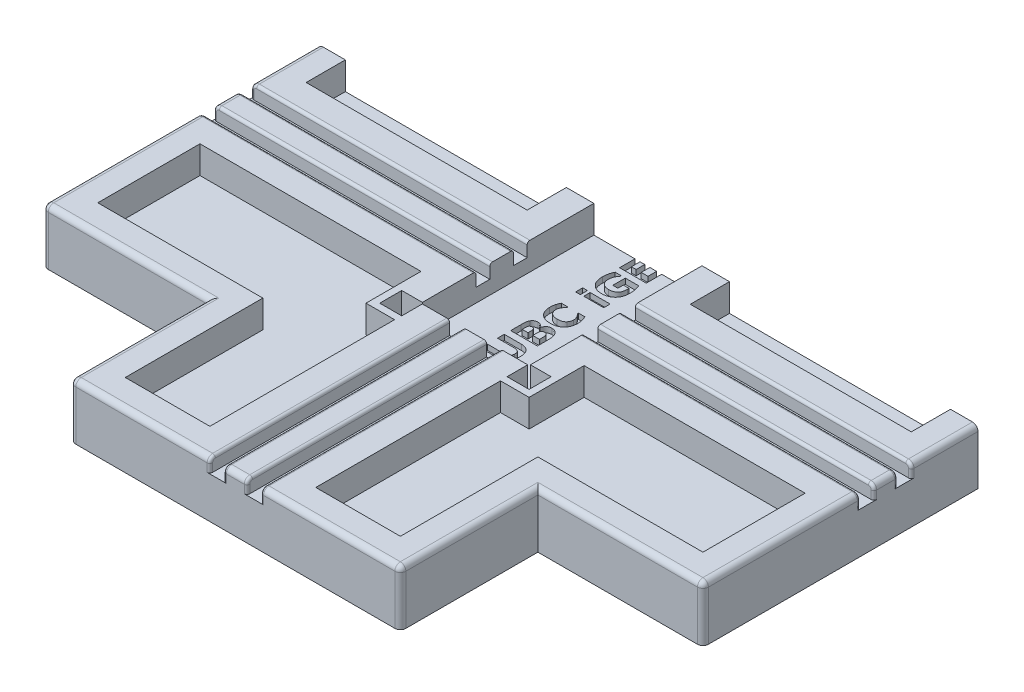
from build123d import *

# Parameters (mm, degrees)
SKETCH1_W                                  = 240
SKETCH1_H                                  = 200
BOSS_EXTRUDE1_DEPTH                        = 20
SKETCH7_W                                  = 120
SKETCH7_H                                  = 50
BOSS_EXTRUDE6_DEPTH                        = 20
FILLET1_R                                  = 2
SKETCH2_W                                  = 39.3
SKETCH2_H                                  = 125.7
CUT_EXTRUDE1_DEPTH                         = 10
CUT_EXTRUDE3_DEPTH                         = 5
MIRROR4_AT_THE_SECOND_PLANE_COPY_1_DEPTH   = 5
SKETCH11_W                                 = 104.748042719
SKETCH11_H                                 = 5
CUT_EXTRUDE4_DEPTH                         = 5
MIRROR6_AT_THE_SECOND_PLANE_COPY_1_SKETC_W = 104.748042719
MIRROR6_AT_THE_SECOND_PLANE_COPY_1_SKETC_H = 5
MIRROR6_AT_THE_SECOND_PLANE_COPY_1_DEPTH   = 5
SHELL1_START                               = 10
SHELL1_OUTLINE_W                           = 80.35
SHELL1_OUTLINE_H                           = 28.5
SHELL1_DEPTH                               = 10
FILLET3_R                                  = 1
SKETCH13_W                                 = 7.252545243
SKETCH13_H                                 = 2.335565418
SKETCH13_W_2                               = 1.720942939
SKETCH13_H_2                               = 2.581414408
CUT_EXTRUDE5_DEPTH                         = 2
CUT_EXTRUDE6_DEPTH                         = 10
MIRROR7_AT_THE_SECOND_PLANE_COPY_1_DEPTH   = 10
SKETCH15_W                                 = 252.845295914
SKETCH15_H                                 = 31.352816693
CUT_EXTRUDE7_DEPTH                         = 194.132079158


# Read off the part's stored shape, not the designer's step: Shell1
with BuildPart() as part:
    # Sketch1 → Boss-Extrude1 (new body)
    with BuildSketch(Plane(origin=(0, 0, 0), x_dir=(1, 0, 0), z_dir=(0, 1, 0))):
        Rectangle(SKETCH1_W, SKETCH1_H)
    extrude(amount=BOSS_EXTRUDE1_DEPTH)

    # Sketch7 → Boss-Extrude6 (add)
    with BuildSketch(Plane(origin=(0, 0, 0), x_dir=(1, 0, 0), z_dir=(0, 1, 0))):
        with Locations((0, 125)):
            Rectangle(SKETCH7_W, SKETCH7_H)
        with Locations((0, -125)):
            Rectangle(SKETCH7_W, SKETCH7_H)
    extrude(amount=BOSS_EXTRUDE6_DEPTH)

    # Fillet1
    fillet1_edges = [part.edges().sort_by_distance(p)[0] for p in [
        (-120, 20, 0),
        (90, 20, 100),
        (-90, 20, 100),
        (-60, 10, 150),
        (60, 10, 150),
        (-60, 20, 125),
        (0, 20, 150),
        (60, 20, 125),
        (-90, 20, -100),
        (60, 20, -125),
        (0, 20, -150),
        (60, 10, -150),
        (-60, 10, -150),
        (-60, 20, -125),
        (120, 20, 0),
        (120, 10, 100),
        (-120, 10, 100),
        (-120, 10, -100),
        (120, 10, -100),
        (90, 20, -100),
    ]]
    fillet(fillet1_edges, radius=FILLET1_R)

    # Sketch2 → Cut-Extrude1 (cut)
    with BuildSketch(Plane(origin=(0, 20, 0), x_dir=(1, 0, 0), z_dir=(0, 1, 0))):
        Rectangle(SKETCH2_W, SKETCH2_H)
    extrude(amount=-CUT_EXTRUDE1_DEPTH, mode=Mode.SUBTRACT)

    # Sketch10 → Cut-Extrude3 (cut)
    with BuildSketch(Plane(origin=(0, 20, 0), x_dir=(1, 0, 0), z_dir=(0, 1, 0))):
        Polygon((-9.25, -40.5), (-9.25, -33.162899401), (-4.25, -33.162899401), (-4.25, -40.5), (-4.25, -156.832928994), (-9.25, -156.832928994), align=None)
    cut_extrude3 = extrude(amount=-CUT_EXTRUDE3_DEPTH, mode=Mode.SUBTRACT)

    # Mirror4: Cut-Extrude3 across plane
    add(cut_extrude3.mirror(Plane(origin=(0, 0, 0), x_dir=(0, 0, 1), z_dir=(1, 0, 0))), mode=Mode.SUBTRACT)

    # Mirror4 at the second plane: Cut-Extrude3 across plane
    add(cut_extrude3.mirror(Plane.XY), mode=Mode.SUBTRACT)

    # Mirror4 at the second plane copy 1 sketc → Mirror4 at the second plane copy 1 (cut)
    with BuildSketch(Plane(origin=(0, 20, 0), x_dir=(-1, 0, 0), z_dir=(0, 1, 0))):
        Polygon((-9.25, -40.5), (-9.25, -33.162899401), (-4.25, -33.162899401), (-4.25, -40.5), (-4.25, -156.832928994), (-9.25, -156.832928994), align=None)
    extrude(amount=-MIRROR4_AT_THE_SECOND_PLANE_COPY_1_DEPTH, mode=Mode.SUBTRACT)

    # Sketch11 → Cut-Extrude4 (cut)
    with BuildSketch(Plane(origin=(0, 20, 0), x_dir=(1, 0, 0), z_dir=(0, 1, 0))):
        with Locations((-72.024021359, 26.75)):
            Rectangle(SKETCH11_W, SKETCH11_H)
        with Locations((-72.024021359, 40.35)):
            Rectangle(SKETCH11_W, SKETCH11_H)
    cut_extrude4 = extrude(amount=-CUT_EXTRUDE4_DEPTH, mode=Mode.SUBTRACT)

    # Mirror6: Cut-Extrude4 across plane
    add(cut_extrude4.mirror(Plane.XY), mode=Mode.SUBTRACT)

    # Mirror6 at the second plane: Cut-Extrude4 across plane
    add(cut_extrude4.mirror(Plane(origin=(0, 0, 0), x_dir=(0, 0, 1), z_dir=(1, 0, 0))), mode=Mode.SUBTRACT)

    # Mirror6 at the second plane copy 1 sketc → Mirror6 at the second plane copy 1 (cut)
    with BuildSketch(Plane(origin=(0, 20, 0), x_dir=(-1, 0, 0), z_dir=(0, 1, 0))):
        with Locations((-72.024021359, 26.75)):
            Rectangle(MIRROR6_AT_THE_SECOND_PLANE_COPY_1_SKETC_W, MIRROR6_AT_THE_SECOND_PLANE_COPY_1_SKETC_H)
        with Locations((-72.024021359, 40.35)):
            Rectangle(MIRROR6_AT_THE_SECOND_PLANE_COPY_1_SKETC_W, MIRROR6_AT_THE_SECOND_PLANE_COPY_1_SKETC_H)
    extrude(amount=-MIRROR6_AT_THE_SECOND_PLANE_COPY_1_DEPTH, mode=Mode.SUBTRACT)

    # Shell1 outline → Shell1 (cut)
    with BuildSketch(Plane(origin=(0, 0, 0), x_dir=(1, 0, 0), z_dir=(0, 1, 0)).offset(SHELL1_START)):
        Polygon((-29.65, 72.85), (-19.25, 72.85), (-19.25, 140), (-50, 140), (-50, 90), (-110, 90), (-110, 52.85), (-29.65, 52.85), align=None)
        Polygon((19.25, 72.85), (29.65, 72.85), (29.65, 52.85), (110, 52.85), (110, 90), (50, 90), (50, 140), (19.25, 140), align=None)
        Polygon((-110, -52.85), (-110, -90), (-50, -90), (-50, -140), (-19.25, -140), (-19.25, -72.85), (-29.65, -72.85), (-29.65, -52.85), align=None)
        with Locations((-69.825, 0)):
            Rectangle(SHELL1_OUTLINE_W, SHELL1_OUTLINE_H)
        Polygon((29.65, -72.85), (19.25, -72.85), (19.25, -140), (50, -140), (50, -90), (110, -90), (110, -52.85), (29.65, -52.85), align=None)
        with Locations((69.825, 0)):
            Rectangle(SHELL1_OUTLINE_W, SHELL1_OUTLINE_H)
    extrude(amount=SHELL1_DEPTH, mode=Mode.SUBTRACT)

    # Fillet3
    fillet3_edges = [part.edges().sort_by_distance(p)[0] for p in [
        (-4.25, 16.5, 150),
        (-4.25, 19.414213562, 149.414213562),
        (-9.25, 16.5, 150),
        (-9.25, 19.414213562, 149.414213562),
        (-4.25, 20, 105.425),
        (-9.25, 20, 105.425),
        (-9.25, 19.414213562, -149.414213562),
        (-9.25, 16.5, -150),
        (-9.25, 20, -105.425),
        (-4.25, 16.5, -150),
        (-4.25, 19.414213562, -149.414213562),
        (-4.25, 20, -105.425),
        (9.25, 16.5, 150),
        (9.25, 20, 105.425),
        (9.25, 19.414213562, 149.414213562),
        (4.25, 16.5, 150),
        (4.25, 19.414213562, 149.414213562),
        (4.25, 20, 105.425),
        (4.25, 16.5, -150),
        (4.25, 19.414213562, -149.414213562),
        (9.25, 19.414213562, -149.414213562),
        (9.25, 16.5, -150),
        (4.25, 20, -105.425),
        (9.25, 20, -105.425),
        (-120, 16.5, -24.25),
        (-120, 16.5, -29.25),
        (-119.414213562, 19.414213562, -24.25),
        (-119.414213562, 19.414213562, -29.25),
        (-68.825, 20, -24.25),
        (-68.825, 20, -29.25),
        (-120, 16.5, -37.85),
        (-120, 16.5, -42.85),
        (-68.825, 20, -37.85),
        (-68.825, 20, -42.85),
        (-119.414213562, 19.414213562, -37.85),
        (-119.414213562, 19.414213562, -42.85),
        (68.825, 20, -29.25),
        (119.414213562, 19.414213562, -29.25),
        (119.414213562, 19.414213562, -24.25),
        (68.825, 20, -24.25),
        (120, 16.5, -29.25),
        (120, 16.5, -24.25),
        (68.825, 20, -42.85),
        (119.414213562, 19.414213562, -42.85),
        (119.414213562, 19.414213562, -37.85),
        (68.825, 20, -37.85),
        (120, 16.5, -42.85),
        (120, 16.5, -37.85),
        (-120, 16.5, 29.25),
        (-120, 16.5, 24.25),
        (-68.825, 20, 29.25),
        (-119.414213562, 19.414213562, 29.25),
        (-119.414213562, 19.414213562, 24.25),
        (-68.825, 20, 24.25),
        (-120, 16.5, 42.85),
        (-120, 16.5, 37.85),
        (-68.825, 20, 42.85),
        (-119.414213562, 19.414213562, 42.85),
        (-119.414213562, 19.414213562, 37.85),
        (-68.825, 20, 37.85),
        (120, 16.5, 24.25),
        (120, 16.5, 29.25),
        (119.414213562, 19.414213562, 24.25),
        (119.414213562, 19.414213562, 29.25),
        (68.825, 20, 24.25),
        (68.825, 20, 29.25),
        (120, 16.5, 37.85),
        (120, 16.5, 42.85),
        (68.825, 20, 37.85),
        (68.825, 20, 42.85),
        (119.414213562, 19.414213562, 37.85),
        (119.414213562, 19.414213562, 42.85),
    ]]
    fillet(fillet3_edges, radius=FILLET3_R)

    # Sketch13 → Cut-Extrude5 (cut)
    # profile 1 of 12: a face of its own
    with BuildSketch(Plane(origin=(0, 10, 0), x_dir=(1, 0, 0), z_dir=(0, 1, 0))):
        Polygon((2.787359078, 56.729654742), (2.787359078, 55.37748529), (5, 55.37748529), (5, 53.041919872), (2.787359078, 53.041919872), (2.787359078, 48.247864542), (0.880108701, 48.247864542), (-4.711035156, 52.886343558), (-4.711035156, 55.37748529), (0.943491644, 55.37748529), (0.943491644, 56.729654742), align=None)
        Polygon((0.943491644, 53.041919872), (-2.596349692, 53.041919872), (0.943491644, 50.110938929), align=None, mode=Mode.SUBTRACT)
    # profile 2 of 12: a face of its own
    with BuildSketch(Plane(origin=(0, 10, 0), x_dir=(1, 0, 0), z_dir=(0, 1, 0))):
        with BuildLine():
            Line((5, 47.141544081), (5, 39.520225351))
            Line((5, 39.520225351), (3.409664338, 39.520225351))
            add(Edge.make_bspline(
                [(3.409664338, 39.520225351), (3.190599668, 39.81675512), (2.747057383, 40.417141716), (2.167094132, 41.14339637), (1.704390868, 41.703253096), (1.381972101, 42.083056551), (1.083256561, 42.417759603), (0.887687077, 42.622007507), (0.79559811, 42.718182933)],
                knots=[0, 0, 0, 0, 1.605452287, 3.25057426, 4.046675402, 4.768563423, 5.420146126, 6, 6, 6, 6], degree=3))
            add(Edge.make_bspline(
                [(0.79559811, 42.718182933), (0.732570292, 42.782561984), (0.609352585, 42.908421315), (0.423765416, 43.085974145), (0.244476812, 43.249198615), (0.074088064, 43.400664381), (-0.092796487, 43.534082219), (-0.252790737, 43.654099684), (-0.406497488, 43.759962438), (-0.599845109, 43.881290453), (-0.837875375, 44.00401532), (-1.125540586, 44.112139625), (-1.412736444, 44.178491494), (-1.604945873, 44.187117789), (-1.699385013, 44.191356186)],
                knots=[0, 0, 0, 0, 1.090093853, 2.131104457, 3.107135244, 4.023908394, 4.888948297, 5.691514549, 6.4435893, 7.146498757, 8.452673016, 9.675803408, 10.85804184, 12, 12, 12, 12], degree=3))
            add(Edge.make_bspline(
                [(-1.699385013, 44.191356186), (-1.754483363, 44.189605987), (-1.861179083, 44.186216799), (-2.017224671, 44.167846758), (-2.162681909, 44.132103765), (-2.300488192, 44.087839319), (-2.42643972, 44.024206924), (-2.544199113, 43.950411254), (-2.650531499, 43.859818439), (-2.749307162, 43.758726543), (-2.834556733, 43.642742478), (-2.911599654, 43.517157005), (-2.971430142, 43.377241787), (-3.024398474, 43.226819474), (-3.063653395, 43.063897589), (-3.092633036, 42.889340485), (-3.109905835, 42.703165878), (-3.111960528, 42.574807759), (-3.113016713, 42.508827152)],
                knots=[0, 0, 0, 0, 1.058578686, 2.049894692, 3.010224385, 3.931750511, 4.822578239, 5.71281177, 6.594427321, 7.498813824, 8.420995957, 9.353043897, 10.321837571, 11.3367408, 12.413304787, 13.535187771, 14.732999458, 16, 16, 16, 16], degree=3))
            add(Edge.make_bspline(
                [(-3.113016713, 42.508827152), (-3.110052719, 42.405568465), (-3.104041103, 42.196137688), (-3.053985994, 41.878413923), (-2.980602684, 41.552282773), (-2.873221808, 41.222921491), (-2.74714341, 40.895094854), (-2.596251992, 40.578640505), (-2.438170844, 40.269132893), (-2.314289691, 40.074405983), (-2.252545243, 39.977350819)],
                knots=[0, 0, 0, 0, 0.914703558, 1.855215137, 2.844920106, 3.875005138, 4.922433174, 5.955639304, 6.981056277, 8, 8, 8, 8], degree=3))
            Line((-2.252545243, 39.977350819), (-2.252545243, 39.766074342))
            Line((-2.252545243, 39.766074342), (-4.363389317, 39.766074342))
            add(Edge.make_bspline(
                [(-4.363389317, 39.766074342), (-4.396975153, 39.85152697), (-4.470639347, 40.038951181), (-4.568658946, 40.352153969), (-4.66491051, 40.720660415), (-4.763825821, 41.132864511), (-4.849735205, 41.573321973), (-4.910075419, 42.024211578), (-4.95119256, 42.474770211), (-4.954991729, 42.775713815), (-4.956884148, 42.92561802)],
                knots=[0, 0, 0, 0, 0.681686624, 1.495150967, 2.435076171, 3.509887788, 4.642826517, 5.765734475, 6.887081194, 8, 8, 8, 8], degree=3))
            add(Edge.make_bspline(
                [(-4.956884148, 42.92561802), (-4.954912362, 43.072306092), (-4.951074185, 43.357841566), (-4.914531776, 43.772464491), (-4.853049644, 44.160650299), (-4.769612134, 44.521836328), (-4.662431161, 44.856562797), (-4.529987596, 45.163893905), (-4.371768891, 45.443672956), (-4.191325, 45.69718541), (-3.986517109, 45.920499957), (-3.762299213, 46.116633841), (-3.516918106, 46.283180062), (-3.250583577, 46.417510178), (-2.964907945, 46.521931142), (-2.659732708, 46.596780352), (-2.333869778, 46.641015432), (-2.109911454, 46.646854566), (-1.995172081, 46.649846099)],
                knots=[0, 0, 0, 0, 1.302669921, 2.535710425, 3.693104205, 4.791067539, 5.825099944, 6.810730835, 7.758000335, 8.67487823, 9.568447078, 10.443087854, 11.315285082, 12.19521531, 13.085757283, 14.011200708, 14.981089066, 16, 16, 16, 16], degree=3))
            add(Edge.make_bspline(
                [(-1.995172081, 46.649846099), (-1.918295051, 46.648245135), (-1.764899121, 46.645050664), (-1.536586701, 46.623146341), (-1.311198259, 46.589276583), (-1.089189633, 46.538876948), (-0.870129482, 46.472993238), (-0.653296175, 46.39436831), (-0.439122967, 46.302496277), (-0.229338943, 46.193054838), (-0.018163961, 46.072147599), (0.191952814, 45.932794317), (0.405837655, 45.781094454), (0.620958688, 45.614342324), (0.835471411, 45.430057751), (1.055741697, 45.23549192), (1.273520634, 45.021368665), (1.417594688, 44.872241147), (1.490889788, 44.796375188)],
                knots=[0, 0, 0, 0, 0.907170522, 1.810115022, 2.704515666, 3.595334857, 4.494160497, 5.402400165, 6.316123003, 7.242010315, 8.19323076, 9.186549597, 10.215937183, 11.28746875, 12.397107329, 13.552885457, 14.755074217, 16, 16, 16, 16], degree=3))
            add(Edge.make_bspline(
                [(1.490889788, 44.796375188), (1.669671754, 44.600991906), (2.021428479, 44.216571794), (2.422503942, 43.720261203), (2.710127438, 43.347225494), (2.892573427, 43.11547907), (3.035611297, 42.923413887), (3.11966375, 42.809753418), (3.156132565, 42.760438229)],
                knots=[0, 0, 0, 0, 1.811045763, 3.563265038, 4.362127914, 5.033096026, 5.580478129, 6, 6, 6, 6], degree=3))
            Line((3.156132565, 42.760438229), (3.156132565, 47.141544081))
            Line((3.156132565, 47.141544081), (5, 47.141544081))
        make_face()
    # profile 3 of 12: a face of its own
    with BuildSketch(Plane(origin=(0, 10, 0), x_dir=(1, 0, 0), z_dir=(0, 1, 0))):
        with BuildLine():
            add(Edge.make_bspline(
                [(0.138720336, 37.553433421), (0.339837036, 37.551198694), (0.731017162, 37.546852061), (1.301575539, 37.503210957), (1.839727263, 37.435290008), (2.344336806, 37.340402007), (2.812295891, 37.218717557), (3.235819492, 37.059739443), (3.620265586, 36.877229499), (3.845547684, 36.720963882), (3.955141787, 36.64494457)],
                knots=[0, 0, 0, 0, 1.210994604, 2.355433537, 3.443919748, 4.476135166, 5.446013627, 6.351277171, 7.197937607, 8, 8, 8, 8], degree=3))
            add(Edge.make_bspline(
                [(3.955141787, 36.64494457), (4.057367971, 36.5617232), (4.260610648, 36.396265258), (4.524020765, 36.101981434), (4.745368417, 35.772676286), (4.897303004, 35.472877401), (4.999247268, 35.217133399), (5.063592063, 35.011802969), (5.122267484, 34.796985151), (5.167723638, 34.570405454), (5.201934481, 34.333084121), (5.226664862, 34.085073274), (5.242295446, 33.825562266), (5.244648027, 33.648682389), (5.245848991, 33.558387312)],
                knots=[0, 0, 0, 0, 1.363120718, 2.710110989, 4.070537742, 5.460816644, 6.180869889, 6.918733188, 7.687278466, 8.485437086, 9.309407483, 10.168795045, 11.065191617, 12, 12, 12, 12], degree=3))
            add(Edge.make_bspline(
                [(5.245848991, 33.558387312), (5.241905689, 33.384062955), (5.234297073, 33.047703496), (5.173081199, 32.562988904), (5.069699732, 32.118069919), (4.926806373, 31.711596248), (4.739854178, 31.34454147), (4.516760058, 31.013155063), (4.251279595, 30.717979546), (4.045332533, 30.554230832), (3.94169692, 30.471830054)],
                knots=[0, 0, 0, 0, 1.200851745, 2.317047666, 3.359233085, 4.342911255, 5.278031965, 6.189548012, 7.088953741, 8, 8, 8, 8], degree=3))
            add(Edge.make_bspline(
                [(3.94169692, 30.471830054), (3.829424185, 30.3947628), (3.600170882, 30.2373967), (3.214838014, 30.049115343), (2.792701976, 29.89168932), (2.331256748, 29.768085058), (1.834031119, 29.675388633), (1.301418942, 29.61187027), (0.734794995, 29.570336966), (0.344952566, 29.565716964), (0.144482422, 29.563341204)],
                knots=[0, 0, 0, 0, 0.822750793, 1.680001256, 2.58557045, 3.544707477, 4.565467581, 5.642347189, 6.787615291, 8, 8, 8, 8], degree=3))
            add(Edge.make_bspline(
                [(0.144482422, 29.563341204), (-0.061754837, 29.565532126), (-0.459970452, 29.569762495), (-1.036345286, 29.613069323), (-1.570746564, 29.680774054), (-2.065452333, 29.775711056), (-2.521358164, 29.900947264), (-2.938473361, 30.06222162), (-3.323134476, 30.249194002), (-3.55325365, 30.406272972), (-3.666176943, 30.483354226)],
                knots=[0, 0, 0, 0, 1.242237956, 2.39858964, 3.479780431, 4.485821505, 5.430991799, 6.32348679, 7.177307181, 8, 8, 8, 8], degree=3))
            add(Edge.make_bspline(
                [(-3.666176943, 30.483354226), (-3.769193286, 30.566416838), (-3.974708441, 30.732124775), (-4.238285133, 31.029639616), (-4.461065672, 31.362253167), (-4.645070962, 31.729678272), (-4.784115122, 32.135791847), (-4.885860052, 32.577168574), (-4.944671996, 33.056148657), (-4.952723667, 33.387282789), (-4.956884148, 33.558387312)],
                knots=[0, 0, 0, 0, 0.915406887, 1.826214983, 2.74012738, 3.682217607, 4.664024873, 5.706462388, 6.814877053, 8, 8, 8, 8], degree=3))
            add(Edge.make_bspline(
                [(-4.956884148, 33.558387312), (-4.955682618, 33.64868302), (-4.953320425, 33.826203271), (-4.937576888, 34.086978277), (-4.913381513, 34.337057391), (-4.877300412, 34.575699285), (-4.828262853, 34.80214551), (-4.773499009, 35.018778584), (-4.706561244, 35.224310597), (-4.601886899, 35.480626422), (-4.447267393, 35.781827029), (-4.217150947, 36.109134402), (-3.948246131, 36.405401156), (-3.739143401, 36.569659884), (-3.633525124, 36.652627351)],
                knots=[0, 0, 0, 0, 0.927772364, 1.823989051, 2.683453821, 3.508702832, 4.302191287, 5.063276402, 5.803871599, 6.520953588, 7.906777029, 9.27188215, 10.622021304, 12, 12, 12, 12], degree=3))
            add(Edge.make_bspline(
                [(-3.633525124, 36.652627351), (-3.521300204, 36.729189524), (-3.292789343, 36.885084383), (-2.908970475, 37.068290297), (-2.492360426, 37.225455121), (-2.036263275, 37.346342452), (-1.54437137, 37.439204828), (-1.015826808, 37.505677425), (-0.450933502, 37.546286922), (-0.061742996, 37.551003841), (0.138720336, 37.553433421)],
                knots=[0, 0, 0, 0, 0.826423845, 1.682753026, 2.582377666, 3.535958882, 4.552416628, 5.629628825, 6.779074777, 8, 8, 8, 8], degree=3))
        make_face()
        with BuildLine():
            add(Edge.make_bspline(
                [(0.138720336, 35.094943508), (-0.002794049, 35.093990238), (-0.275052116, 35.092156251), (-0.667644343, 35.074004214), (-1.028464631, 35.048543297), (-1.357952356, 35.010483072), (-1.656192237, 34.961169576), (-1.923473104, 34.900935006), (-2.158488294, 34.828227196), (-2.363936988, 34.745989678), (-2.54162794, 34.64913888), (-2.69467252, 34.537908006), (-2.823572221, 34.410664927), (-2.931286275, 34.270097317), (-3.011274034, 34.111739825), (-3.072443859, 33.941187009), (-3.106785969, 33.754382189), (-3.110895684, 33.625106618), (-3.113016713, 33.558387312)],
                knots=[0, 0, 0, 0, 1.684598718, 3.240982106, 4.677870026, 5.990101975, 7.188004416, 8.275163324, 9.249099904, 10.113910365, 10.905306099, 11.652292794, 12.358339015, 13.054983843, 13.750418457, 14.461547751, 15.206002611, 16, 16, 16, 16], degree=3))
            add(Edge.make_bspline(
                [(-3.113016713, 33.558387312), (-3.110895681, 33.491668012), (-3.106785962, 33.362392453), (-3.072443884, 33.175587552), (-3.011273943, 33.005035023), (-2.931286606, 32.84667649), (-2.823570979, 32.706112772), (-2.694677343, 32.578854684), (-2.541608299, 32.467684345), (-2.363496496, 32.37029911), (-2.157013742, 32.289020864), (-1.921590867, 32.215742751), (-1.654258135, 32.155647372), (-1.355414385, 32.106122047), (-1.024612933, 32.068276855), (-0.661244964, 32.04269777), (-0.266085327, 32.024665897), (0.008090715, 32.022799039), (0.150244508, 32.021831116)],
                knots=[0, 0, 0, 0, 0.791766581, 1.534129826, 2.243261137, 2.936741863, 3.631429404, 4.335491923, 5.08037989, 5.869552125, 6.738971147, 7.710171362, 8.794275798, 9.988812621, 11.304907075, 12.745337551, 14.312534512, 16, 16, 16, 16], degree=3))
            add(Edge.make_bspline(
                [(0.150244508, 32.021831116), (0.289201434, 32.022765136), (0.556986265, 32.024565091), (0.943773412, 32.043063349), (1.30096878, 32.067483158), (1.627502144, 32.109075315), (1.924420257, 32.156514098), (2.190195476, 32.220950105), (2.427221865, 32.292197549), (2.635687527, 32.376524358), (2.816464841, 32.475577579), (2.974492505, 32.586386469), (3.106149375, 32.714997304), (3.215613674, 32.855867424), (3.298888327, 33.012083539), (3.358752163, 33.181622444), (3.396338685, 33.365314373), (3.400067537, 33.492898418), (3.401981557, 33.558387312)],
                knots=[0, 0, 0, 0, 1.658832269, 3.196746878, 4.622488866, 5.931787449, 7.125569234, 8.210133994, 9.194149195, 10.078471196, 10.889203548, 11.650697572, 12.375032472, 13.07829054, 13.77251817, 14.478471121, 15.218999177, 16, 16, 16, 16], degree=3))
            add(Edge.make_bspline(
                [(3.401981557, 33.558387312), (3.400068186, 33.623876875), (3.3963406, 33.751462223), (3.358745104, 33.935144911), (3.298913291, 34.10471679), (3.215521541, 34.260812329), (3.106775331, 34.40178813), (2.97377315, 34.528364287), (2.816557237, 34.639341559), (2.635707586, 34.738476019), (2.42683161, 34.821967534), (2.190341985, 34.897522561), (1.921851262, 34.956560743), (1.624132619, 35.009519497), (1.295502071, 35.045529443), (0.936895825, 35.074962985), (0.547988509, 35.091838226), (0.278306115, 35.093884415), (0.138720336, 35.094943508)],
                knots=[0, 0, 0, 0, 0.778971247, 1.517574904, 2.221693305, 2.914116855, 3.615547377, 4.332711038, 5.092226179, 5.900851692, 6.782875619, 7.766611013, 8.854037796, 10.053520173, 11.366075456, 12.788704916, 14.337855446, 16, 16, 16, 16], degree=3))
        make_face(mode=Mode.SUBTRACT)
    # profile 4 of 12: a face of its own
    with BuildSketch(Plane(origin=(0, 10, 0), x_dir=(1, 0, 0), z_dir=(0, 1, 0))):
        with BuildLine():
            Line((5, 28.211171751), (5, 20.589853021))
            Line((5, 20.589853021), (3.409664338, 20.589853021))
            add(Edge.make_bspline(
                [(3.409664338, 20.589853021), (3.190599668, 20.88638279), (2.747057383, 21.486769386), (2.167094132, 22.21302404), (1.704390868, 22.772880767), (1.381972101, 23.152684221), (1.083256561, 23.487387273), (0.887687077, 23.691635177), (0.79559811, 23.787810603)],
                knots=[0, 0, 0, 0, 1.605452287, 3.25057426, 4.046675402, 4.768563423, 5.420146126, 6, 6, 6, 6], degree=3))
            add(Edge.make_bspline(
                [(0.79559811, 23.787810603), (0.732570292, 23.852189654), (0.609352585, 23.978048985), (0.423765416, 24.155601815), (0.244476812, 24.318826285), (0.074088064, 24.470292051), (-0.092796487, 24.60370989), (-0.252790737, 24.723727355), (-0.406497488, 24.829590108), (-0.599845109, 24.950918123), (-0.837875375, 25.07364299), (-1.125540586, 25.181767295), (-1.412736444, 25.248119164), (-1.604945873, 25.256745459), (-1.699385013, 25.260983856)],
                knots=[0, 0, 0, 0, 1.090093853, 2.131104457, 3.107135244, 4.023908394, 4.888948297, 5.691514549, 6.4435893, 7.146498757, 8.452673016, 9.675803408, 10.85804184, 12, 12, 12, 12], degree=3))
            add(Edge.make_bspline(
                [(-1.699385013, 25.260983856), (-1.754483363, 25.259233658), (-1.861179083, 25.25584447), (-2.017224671, 25.237474428), (-2.162681909, 25.201731435), (-2.300488192, 25.157466989), (-2.42643972, 25.093834595), (-2.544199113, 25.020038924), (-2.650531499, 24.929446109), (-2.749307162, 24.828354213), (-2.834556733, 24.712370148), (-2.911599654, 24.586784675), (-2.971430142, 24.446869457), (-3.024398474, 24.296447144), (-3.063653395, 24.133525259), (-3.092633036, 23.958968155), (-3.109905835, 23.772793548), (-3.111960528, 23.644435429), (-3.113016713, 23.578454822)],
                knots=[0, 0, 0, 0, 1.058578686, 2.049894692, 3.010224385, 3.931750511, 4.822578239, 5.71281177, 6.594427321, 7.498813824, 8.420995957, 9.353043897, 10.321837571, 11.3367408, 12.413304787, 13.535187771, 14.732999458, 16, 16, 16, 16], degree=3))
            add(Edge.make_bspline(
                [(-3.113016713, 23.578454822), (-3.110052719, 23.475196136), (-3.104041103, 23.265765358), (-3.053985994, 22.948041593), (-2.980602684, 22.621910443), (-2.873221808, 22.292549161), (-2.74714341, 21.964722525), (-2.596251992, 21.648268175), (-2.438170844, 21.338760563), (-2.314289691, 21.144033653), (-2.252545243, 21.046978489)],
                knots=[0, 0, 0, 0, 0.914703558, 1.855215137, 2.844920106, 3.875005138, 4.922433174, 5.955639304, 6.981056277, 8, 8, 8, 8], degree=3))
            Line((-2.252545243, 21.046978489), (-2.252545243, 20.835702012))
            Line((-2.252545243, 20.835702012), (-4.363389317, 20.835702012))
            add(Edge.make_bspline(
                [(-4.363389317, 20.835702012), (-4.396975153, 20.92115464), (-4.470639347, 21.108578851), (-4.568658946, 21.421781639), (-4.66491051, 21.790288086), (-4.763825821, 22.202492181), (-4.849735205, 22.642949643), (-4.910075419, 23.093839248), (-4.95119256, 23.544397881), (-4.954991729, 23.845341485), (-4.956884148, 23.99524569)],
                knots=[0, 0, 0, 0, 0.681686624, 1.495150967, 2.435076171, 3.509887788, 4.642826517, 5.765734475, 6.887081194, 8, 8, 8, 8], degree=3))
            add(Edge.make_bspline(
                [(-4.956884148, 23.99524569), (-4.954912362, 24.141933762), (-4.951074185, 24.427469237), (-4.914531776, 24.842092162), (-4.853049644, 25.230277969), (-4.769612134, 25.591463998), (-4.662431161, 25.926190468), (-4.529987596, 26.233521576), (-4.371768891, 26.513300626), (-4.191325, 26.76681308), (-3.986517109, 26.990127627), (-3.762299213, 27.186261512), (-3.516918106, 27.352807733), (-3.250583577, 27.487137848), (-2.964907945, 27.591558812), (-2.659732708, 27.666408023), (-2.333869778, 27.710643103), (-2.109911454, 27.716482236), (-1.995172081, 27.719473769)],
                knots=[0, 0, 0, 0, 1.302669921, 2.535710425, 3.693104205, 4.791067539, 5.825099944, 6.810730835, 7.758000335, 8.67487823, 9.568447078, 10.443087854, 11.315285082, 12.19521531, 13.085757283, 14.011200708, 14.981089066, 16, 16, 16, 16], degree=3))
            add(Edge.make_bspline(
                [(-1.995172081, 27.719473769), (-1.918295051, 27.717872805), (-1.764899121, 27.714678334), (-1.536586701, 27.692774011), (-1.311198259, 27.658904253), (-1.089189633, 27.608504619), (-0.870129482, 27.542620908), (-0.653296175, 27.46399598), (-0.439122967, 27.372123947), (-0.229338943, 27.262682508), (-0.018163961, 27.141775269), (0.191952814, 27.002421987), (0.405837655, 26.850722124), (0.620958688, 26.683969994), (0.835471411, 26.499685422), (1.055741697, 26.30511959), (1.273520634, 26.090996335), (1.417594688, 25.941868817), (1.490889788, 25.866002858)],
                knots=[0, 0, 0, 0, 0.907170522, 1.810115022, 2.704515666, 3.595334857, 4.494160497, 5.402400165, 6.316123003, 7.242010315, 8.19323076, 9.186549597, 10.215937183, 11.28746875, 12.397107329, 13.552885457, 14.755074217, 16, 16, 16, 16], degree=3))
            add(Edge.make_bspline(
                [(1.490889788, 25.866002858), (1.669671754, 25.670619576), (2.021428479, 25.286199464), (2.422503942, 24.789888873), (2.710127438, 24.416853164), (2.892573427, 24.18510674), (3.035611297, 23.993041557), (3.11966375, 23.879381088), (3.156132565, 23.830065899)],
                knots=[0, 0, 0, 0, 1.811045763, 3.563265038, 4.362127914, 5.033096026, 5.580478129, 6, 6, 6, 6], degree=3))
            Line((3.156132565, 23.830065899), (3.156132565, 28.211171751))
            Line((3.156132565, 28.211171751), (5, 28.211171751))
        make_face()
    # profile 5 of 12: a face of its own
    with BuildSketch(Plane(origin=(0, 10, 0), x_dir=(1, 0, 0), z_dir=(0, 1, 0))):
        Polygon((5, 13.583156769), (5, 11.124666856), (-1.524601746, 11.124666856), (2.664434583, 9.338420279), (2.664434583, 7.625160121), (-1.524601746, 5.838913543), (5, 5.838913543), (5, 3.503348126), (-4.711035156, 3.503348126), (-4.711035156, 6.382470298), (0.125275469, 8.549014533), (-4.711035156, 10.709796683), (-4.711035156, 13.583156769), align=None)
    # profile 6 of 12: a face of its own
    with BuildSketch(Plane(origin=(0, 10, 0), x_dir=(1, 0, 0), z_dir=(0, 1, 0))):
        Polygon((5, 1.4136317), (5, -5.593064552), (-4.711035156, -5.593064552), (-4.711035156, 1.4136317), (-2.867167722, 1.4136317), (-2.867167722, -3.134574639), (-1.146224782, -3.134574639), (-1.146224782, 1.044858213), (0.697642652, 1.044858213), (0.697642652, -3.134574639), (3.156132565, -3.134574639), (3.156132565, 1.4136317), align=None)
    # profile 7 of 12: a face of its own
    with BuildSketch(Plane(origin=(0, 10, 0), x_dir=(1, 0, 0), z_dir=(0, 1, 0))):
        with BuildLine():
            add(Edge.make_bspline(
                [(4.475650198, -7.805705474), (4.519354839, -7.923859504), (4.612512661, -8.17570855), (4.743574124, -8.583890089), (4.866671289, -9.047274178), (4.996208031, -9.552124696), (5.106381276, -10.084227717), (5.187397941, -10.625264318), (5.237323662, -11.165972628), (5.243010567, -11.526628491), (5.245848991, -11.706637515)],
                knots=[0, 0, 0, 0, 0.756485239, 1.612472169, 2.573171414, 3.635272123, 4.742182008, 5.834553763, 6.919191659, 8, 8, 8, 8], degree=3))
            add(Edge.make_bspline(
                [(5.245848991, -11.706637515), (5.241962961, -11.909112321), (5.234392087, -12.303579456), (5.17063924, -12.878829296), (5.062937634, -13.419584917), (4.916847086, -13.928231287), (4.72267015, -14.400885619), (4.491042888, -14.842463027), (4.211679163, -15.247896521), (3.893490591, -15.618759753), (3.53655883, -15.9505899), (3.145758166, -16.239699566), (2.72146993, -16.48347792), (2.264846611, -16.681095463), (1.776896349, -16.838089964), (1.255150105, -16.944841813), (0.702111097, -17.014888699), (0.322052776, -17.021601157), (0.127196165, -17.025042647)],
                knots=[0, 0, 0, 0, 1.160705024, 2.261318311, 3.313123859, 4.319096107, 5.290496718, 6.238021168, 7.172737693, 8.107230733, 9.03451477, 9.961071912, 10.888559376, 11.833805606, 12.808979065, 13.821966168, 14.883317984, 16, 16, 16, 16], degree=3))
            add(Edge.make_bspline(
                [(0.127196165, -17.025042647), (-0.058682323, -17.02067815), (-0.422730133, -17.012130168), (-0.955049114, -16.943336637), (-1.460067022, -16.832867692), (-1.937766829, -16.677677821), (-2.386372436, -16.473696921), (-2.808700267, -16.227656485), (-3.203463564, -15.935836699), (-3.565000576, -15.598836264), (-3.895700628, -15.226075236), (-4.177610929, -14.810267907), (-4.422741814, -14.363406013), (-4.616779655, -13.8775432), (-4.772219277, -13.359136807), (-4.876169413, -12.804694831), (-4.946971316, -12.216810998), (-4.953520434, -11.812500101), (-4.956884148, -11.604840667)],
                knots=[0, 0, 0, 0, 1.061573339, 2.079118747, 3.060574866, 4.011305467, 4.942696719, 5.870461571, 6.798745348, 7.740825567, 8.68941507, 9.638984161, 10.604583371, 11.595514188, 12.621960228, 13.691449096, 14.814297672, 16, 16, 16, 16], degree=3))
            add(Edge.make_bspline(
                [(-4.956884148, -11.604840667), (-4.954318925, -11.445386322), (-4.949235323, -11.129389392), (-4.919388643, -10.661251886), (-4.863951384, -10.205248288), (-4.792453594, -9.753475749), (-4.684946461, -9.294730481), (-4.534849919, -8.818874824), (-4.346707534, -8.316660693), (-4.193287983, -7.980233106), (-4.113698935, -7.805705474)],
                knots=[0, 0, 0, 0, 0.974479143, 1.931163549, 2.86485946, 3.780778834, 4.725046501, 5.741022375, 6.828116267, 8, 8, 8, 8], degree=3))
            Line((-4.113698935, -7.805705474), (-1.883771756, -7.805705474))
            Line((-1.883771756, -7.805705474), (-1.883771756, -8.091889065))
            add(Edge.make_bspline(
                [(-1.883771756, -8.091889065), (-1.906716104, -8.126531064), (-1.957410079, -8.203070203), (-2.043059993, -8.326945943), (-2.137489474, -8.476111594), (-2.284548962, -8.694884397), (-2.45960062, -8.978067997), (-2.581693909, -9.213466955), (-2.640525683, -9.326896107)],
                knots=[0, 0, 0, 0, 0.515980687, 1.140024195, 1.869947604, 2.707876564, 4.413660046, 6, 6, 6, 6], degree=3))
            add(Edge.make_bspline(
                [(-2.640525683, -9.326896107), (-2.672756546, -9.393740863), (-2.73882048, -9.530753251), (-2.823836627, -9.749019276), (-2.905177649, -9.981830174), (-2.978097, -10.22950925), (-3.037034138, -10.489919732), (-3.082413494, -10.759686706), (-3.106467195, -11.03779789), (-3.110821171, -11.225783758), (-3.113016713, -11.320577771)],
                knots=[0, 0, 0, 0, 0.861448091, 1.765719082, 2.717953576, 3.724891765, 4.761927522, 5.816719679, 6.89905606, 8, 8, 8, 8], degree=3))
            add(Edge.make_bspline(
                [(-3.113016713, -11.320577771), (-3.110164997, -11.430782772), (-3.104578279, -11.646682304), (-3.068710383, -11.963218824), (-3.004292393, -12.263584213), (-2.918860854, -12.549882667), (-2.805175217, -12.820581595), (-2.662381265, -13.075068024), (-2.499039638, -13.320076357), (-2.36711736, -13.466852812), (-2.300562624, -13.540901474)],
                knots=[0, 0, 0, 0, 1.091217493, 2.137773647, 3.148547478, 4.129133693, 5.092188092, 6.048375109, 7.015406034, 8, 8, 8, 8], degree=3))
            add(Edge.make_bspline(
                [(-2.300562624, -13.540901474), (-2.231129169, -13.608753509), (-2.090799964, -13.745886571), (-1.846186727, -13.91943259), (-1.579009792, -14.07619004), (-1.283734201, -14.208811415), (-0.962723927, -14.314570988), (-0.616833633, -14.387928819), (-0.248028071, -14.435679856), (0.006035391, -14.440927383), (0.136799641, -14.443628239)],
                knots=[0, 0, 0, 0, 0.871242595, 1.760833901, 2.686460846, 3.652134751, 4.663748384, 5.717797841, 6.825370436, 8, 8, 8, 8], degree=3))
            add(Edge.make_bspline(
                [(0.136799641, -14.443628239), (0.270078203, -14.441217619), (0.528956778, -14.436535262), (0.904701948, -14.395518364), (1.257245759, -14.329288021), (1.585144219, -14.233472949), (1.889752999, -14.11198958), (2.170660406, -13.964565335), (2.424839249, -13.78559248), (2.657673098, -13.584235453), (2.862193118, -13.352834409), (3.041867765, -13.096983341), (3.191530728, -12.813783401), (3.315763592, -12.506455713), (3.407777269, -12.172177215), (3.477785429, -11.813452581), (3.51753353, -11.428392977), (3.522401475, -11.163169785), (3.524906052, -11.026711399)],
                knots=[0, 0, 0, 0, 1.162877018, 2.258757441, 3.29433279, 4.289818334, 5.235063129, 6.152415668, 7.05144509, 7.94239879, 8.832861761, 9.739671241, 10.664582224, 11.622279774, 12.626959197, 13.685538709, 14.809200461, 16, 16, 16, 16], degree=3))
            add(Edge.make_bspline(
                [(3.524906052, -11.026711399), (3.524545414, -10.976125561), (3.523787414, -10.869802624), (3.51698298, -10.707868976), (3.511542352, -10.544994826), (3.50110347, -10.438303115), (3.496095624, -10.387119882)],
                knots=[0, 0, 0, 0, 0.947728294, 1.991965744, 3.036685378, 4, 4, 4, 4], degree=3))
            Line((3.496095624, -10.387119882), (1.435189626, -10.387119882))
            Line((1.435189626, -10.387119882), (1.435189626, -12.353911813))
            Line((1.435189626, -12.353911813), (-0.408677809, -12.353911813))
            Line((-0.408677809, -12.353911813), (-0.408677809, -7.805705474))
            Line((-0.408677809, -7.805705474), (4.475650198, -7.805705474))
        make_face()
    # profile 8 of 12: a face of its own
    with BuildSketch(Plane(origin=(0, 10, 0), x_dir=(1, 0, 0), z_dir=(0, 1, 0))):
        with Locations((1.373727378, -19.913768295)):
            Rectangle(SKETCH13_W, SKETCH13_H)
    # profile 9 of 12: a face of its own
    with BuildSketch(Plane(origin=(0, 10, 0), x_dir=(1, 0, 0), z_dir=(0, 1, 0))):
        with Locations((-4.219337174, -19.913768295)):
            Rectangle(SKETCH13_W_2, SKETCH13_H_2)
    # profile 10 of 12: a face of its own
    with BuildSketch(Plane(origin=(0, 10, 0), x_dir=(1, 0, 0), z_dir=(0, 1, 0))):
        with BuildLine():
            add(Edge.make_bspline(
                [(5.245848991, -30.773379208), (5.241556228, -30.949600555), (5.233101922, -31.296656552), (5.17328717, -31.807137753), (5.071443943, -32.296870987), (4.929457053, -32.76358831), (4.750483589, -33.205121013), (4.527408056, -33.614715808), (4.267338932, -33.994815031), (4.061606502, -34.220067298), (3.958983177, -34.332427496)],
                knots=[0, 0, 0, 0, 1.089850102, 2.146385891, 3.173869964, 4.179760968, 5.160008291, 6.115072822, 7.059761785, 8, 8, 8, 8], degree=3))
            add(Edge.make_bspline(
                [(3.958983177, -34.332427496), (3.848038568, -34.438295465), (3.624492228, -34.651612698), (3.240912088, -34.92404395), (2.819806379, -35.161121156), (2.440058042, -35.326067869), (2.118408243, -35.437370727), (1.865302565, -35.510926057), (1.602961267, -35.571890876), (1.331038558, -35.621175666), (1.050675199, -35.662875321), (0.76008365, -35.687900337), (0.460358885, -35.70657835), (0.257194686, -35.708560179), (0.154085898, -35.709565986)],
                knots=[0, 0, 0, 0, 1.326589366, 2.672993315, 4.060770367, 5.505883836, 6.25107509, 7.007321983, 7.7873399, 8.582269437, 9.400071632, 10.240855478, 11.107208546, 12, 12, 12, 12], degree=3))
            add(Edge.make_bspline(
                [(0.154085898, -35.709565986), (-0.036260272, -35.705853317), (-0.409159179, -35.698579988), (-0.954067146, -35.631518817), (-1.472101576, -35.524248732), (-1.962272567, -35.375865598), (-2.421254864, -35.182794221), (-2.847342954, -34.951680217), (-3.242424741, -34.683652344), (-3.47520079, -34.471076121), (-3.591269829, -34.365079315)],
                knots=[0, 0, 0, 0, 1.119324668, 2.1928203, 3.223958197, 4.228260008, 5.200520162, 6.147632129, 7.076354466, 8, 8, 8, 8], degree=3))
            add(Edge.make_bspline(
                [(-3.591269829, -34.365079315), (-3.696426816, -34.256022231), (-3.907914238, -34.036691095), (-4.17855444, -33.660997219), (-4.413868173, -33.249571895), (-4.610724175, -32.802820982), (-4.765892728, -32.325941651), (-4.877010675, -31.82562766), (-4.943259501, -31.303347455), (-4.952287649, -30.948354573), (-4.956884148, -30.767617122)],
                knots=[0, 0, 0, 0, 0.919195442, 1.8486482, 2.803167129, 3.793795735, 4.808307604, 5.844199062, 6.902417522, 8, 8, 8, 8], degree=3))
            add(Edge.make_bspline(
                [(-4.956884148, -30.767617122), (-4.956393428, -30.668359933), (-4.955436829, -30.474869682), (-4.94084827, -30.191814102), (-4.921289403, -29.923828157), (-4.879474294, -29.592200908), (-4.814808823, -29.204474119), (-4.7421777, -28.904822537), (-4.707193766, -28.760490591)],
                knots=[0, 0, 0, 0, 0.880714095, 1.716848845, 2.514717796, 3.264532192, 4.682418473, 6, 6, 6, 6], degree=3))
            add(Edge.make_bspline(
                [(-4.707193766, -28.760490591), (-4.664108705, -28.621612355), (-4.581310973, -28.354726269), (-4.434982607, -27.98111963), (-4.28414942, -27.652264541), (-4.186257609, -27.446632632), (-4.140588669, -27.350700282)],
                knots=[0, 0, 0, 0, 1.146660616, 2.203568899, 3.161920647, 4, 4, 4, 4], degree=3))
            Line((-4.140588669, -27.350700282), (-1.760847261, -27.350700282))
            Line((-1.760847261, -27.350700282), (-1.760847261, -27.636883873))
            add(Edge.make_bspline(
                [(-1.760847261, -27.636883873), (-1.789760882, -27.669445598), (-1.850028949, -27.737317837), (-1.943169449, -27.84646079), (-2.044289807, -27.966859077), (-2.193791638, -28.146156267), (-2.382825876, -28.396964235), (-2.52216278, -28.612309765), (-2.594428997, -28.723997382)],
                knots=[0, 0, 0, 0, 0.571444814, 1.191129738, 1.882836886, 2.634784766, 4.254652092, 6, 6, 6, 6], degree=3))
            add(Edge.make_bspline(
                [(-2.594428997, -28.723997382), (-2.664236929, -28.846886536), (-2.805685787, -29.09589163), (-2.943550161, -29.429418426), (-3.032587435, -29.709146116), (-3.077362003, -29.929392289), (-3.107853006, -30.156624515), (-3.111280534, -30.311028434), (-3.113016713, -30.389240159)],
                knots=[0, 0, 0, 0, 1.439173741, 2.916136845, 3.667290802, 4.427345131, 5.203387771, 6, 6, 6, 6], degree=3))
            add(Edge.make_bspline(
                [(-3.113016713, -30.389240159), (-3.110477824, -30.475745648), (-3.105440763, -30.647369353), (-3.07497042, -30.902187581), (-3.020147889, -31.150575186), (-2.946619655, -31.393340851), (-2.845477271, -31.627774464), (-2.718252775, -31.853674636), (-2.562057311, -32.070037457), (-2.439651919, -32.20231689), (-2.377390434, -32.269600803)],
                knots=[0, 0, 0, 0, 1.001598119, 1.9871338, 2.96553644, 3.943152672, 4.919306753, 5.914963555, 6.939446524, 8, 8, 8, 8], degree=3))
            add(Edge.make_bspline(
                [(-2.377390434, -32.269600803), (-2.309583745, -32.332034441), (-2.171025631, -32.45961311), (-1.93152049, -32.625206542), (-1.660665123, -32.770051169), (-1.360441958, -32.900067806), (-1.026703819, -33.004078191), (-0.659549693, -33.075068855), (-0.259970233, -33.119887624), (0.017588233, -33.125326369), (0.161768679, -33.128151577)],
                knots=[0, 0, 0, 0, 0.80388915, 1.642689914, 2.53299325, 3.481872775, 4.4947599, 5.577680681, 6.741702658, 8, 8, 8, 8], degree=3))
            add(Edge.make_bspline(
                [(0.161768679, -33.128151577), (0.311768837, -33.125923628), (0.599876693, -33.121644368), (1.011428999, -33.069407329), (1.386636838, -32.994288328), (1.721395513, -32.879071876), (2.020823568, -32.741957475), (2.287301408, -32.588864868), (2.521133588, -32.418332338), (2.653723475, -32.287257692), (2.71821405, -32.223504117)],
                knots=[0, 0, 0, 0, 1.290334302, 2.478367041, 3.565730986, 4.578276722, 5.517838544, 6.396912514, 7.220272109, 8, 8, 8, 8], degree=3))
            add(Edge.make_bspline(
                [(2.71821405, -32.223504117), (2.776624204, -32.15678903), (2.892154246, -32.024832576), (3.038823686, -31.808811236), (3.156499876, -31.579934787), (3.248205125, -31.341825956), (3.315689405, -31.098752861), (3.366730598, -30.856410279), (3.396189151, -30.615336617), (3.400060024, -30.45525906), (3.401981557, -30.375795292)],
                knots=[0, 0, 0, 0, 1.054325691, 2.085361559, 3.097224921, 4.110091334, 5.115626892, 6.095649915, 7.054665517, 8, 8, 8, 8], degree=3))
            add(Edge.make_bspline(
                [(3.401981557, -30.375795292), (3.399995416, -30.300167635), (3.396010997, -30.148450175), (3.367969377, -29.92183692), (3.324531763, -29.696128902), (3.260202951, -29.473850088), (3.18176618, -29.256712893), (3.091757836, -29.045457401), (2.985752349, -28.843934907), (2.905928292, -28.715220777), (2.866107583, -28.651010962)],
                knots=[0, 0, 0, 0, 0.991289386, 1.988636345, 2.989438367, 4.001683697, 5.01851186, 6.01479875, 7.009670459, 8, 8, 8, 8], degree=3))
            add(Edge.make_bspline(
                [(2.866107583, -28.651010962), (2.799086235, -28.54754028), (2.667016335, -28.343644611), (2.482727048, -28.10690862), (2.33514417, -27.932313621), (2.23417018, -27.813138173), (2.139586208, -27.707238781), (2.078704196, -27.641290482), (2.049812104, -27.60999414)],
                knots=[0, 0, 0, 0, 1.674278229, 3.299273488, 4.071081905, 4.780574956, 5.421311183, 6, 6, 6, 6], degree=3))
            Line((2.049812104, -27.60999414), (2.049812104, -27.350700282))
            Line((2.049812104, -27.350700282), (4.400743084, -27.350700282))
            add(Edge.make_bspline(
                [(4.400743084, -27.350700282), (4.453977989, -27.469107265), (4.557995254, -27.700466195), (4.710217804, -28.043257711), (4.853488894, -28.385337096), (4.925202683, -28.621478965), (4.961586095, -28.741283639)],
                knots=[0, 0, 0, 0, 1.037949104, 2.028079651, 2.999562103, 4, 4, 4, 4], degree=3))
            add(Edge.make_bspline(
                [(4.961586095, -28.741283639), (5.004421769, -28.893824294), (5.086847599, -29.1873481), (5.164067273, -29.560966602), (5.209771736, -29.869797121), (5.23105018, -30.136648007), (5.244470102, -30.442236078), (5.245371714, -30.658760047), (5.245848991, -30.773379208)],
                knots=[0, 0, 0, 0, 1.383532347, 2.662238992, 3.328886368, 4.109040656, 4.999001483, 6, 6, 6, 6], degree=3))
        make_face()
    # profile 11 of 12: a face of its own
    with BuildSketch(Plane(origin=(0, 10, 0), x_dir=(1, 0, 0), z_dir=(0, 1, 0))):
        with BuildLine():
            add(Edge.make_bspline(
                [(2.021001676, -36.938810942), (2.135834195, -36.941779245), (2.360423317, -36.947584644), (2.687160369, -37.003329886), (2.994969738, -37.09114997), (3.282415269, -37.214700456), (3.547482787, -37.370068437), (3.793917062, -37.547462735), (4.012640519, -37.757602713), (4.139226852, -37.914392754), (4.202911474, -37.993272632)],
                knots=[0, 0, 0, 0, 1.09475917, 2.141126953, 3.152168046, 4.142704369, 5.117043167, 6.078545687, 7.033330935, 8, 8, 8, 8], degree=3))
            add(Edge.make_bspline(
                [(4.202911474, -37.993272632), (4.271430436, -38.089328613), (4.40755836, -38.280164856), (4.576639788, -38.587433573), (4.713481332, -38.908937379), (4.823111743, -39.248810358), (4.903771308, -39.619354907), (4.959791089, -40.029680334), (4.994197282, -40.485748637), (4.998006227, -40.805105318), (5, -40.972270956)],
                knots=[0, 0, 0, 0, 0.900219365, 1.788482918, 2.670971805, 3.564424711, 4.510769046, 5.562163026, 6.723926581, 8, 8, 8, 8], degree=3))
            Line((5, -40.972270956), (5, -45.174752151))
            Line((5, -45.174752151), (-4.711035156, -45.174752151))
            Line((-4.711035156, -45.174752151), (-4.711035156, -41.425555034))
            add(Edge.make_bspline(
                [(-4.711035156, -41.425555034), (-4.710541486, -41.331439942), (-4.70958769, -41.149604829), (-4.705841049, -40.887095211), (-4.699877008, -40.643807445), (-4.693192491, -40.420271668), (-4.681063463, -40.216067051), (-4.668157953, -40.032247924), (-4.652477333, -39.867707729), (-4.630893633, -39.673277593), (-4.585539799, -39.443346024), (-4.510417909, -39.173669198), (-4.412392074, -38.905016505), (-4.330200075, -38.730862363), (-4.288482202, -38.642467624)],
                knots=[0, 0, 0, 0, 1.191100834, 2.301266995, 3.32247628, 4.271027234, 5.131271201, 5.911180066, 6.602939548, 7.223035301, 8.386250696, 9.563798057, 10.763466492, 12, 12, 12, 12], degree=3))
            add(Edge.make_bspline(
                [(-4.288482202, -38.642467624), (-4.24037863, -38.555082717), (-4.14649073, -38.384526039), (-3.96681891, -38.160482297), (-3.766354069, -37.969249234), (-3.540529018, -37.816186883), (-3.294523859, -37.699130329), (-3.031217773, -37.613886068), (-2.750649461, -37.563414018), (-2.558140696, -37.556803917), (-2.45998033, -37.553433421)],
                knots=[0, 0, 0, 0, 1.062471767, 2.073717987, 3.049750995, 4.008349348, 4.970663542, 5.946983296, 6.953165217, 8, 8, 8, 8], degree=3))
            add(Edge.make_bspline(
                [(-2.45998033, -37.553433421), (-2.34632125, -37.557744982), (-2.123212386, -37.56620843), (-1.799163202, -37.636330667), (-1.497547426, -37.755993777), (-1.217510903, -37.917931504), (-0.962107245, -38.123087774), (-0.737146443, -38.36942586), (-0.539239297, -38.653150081), (-0.437787245, -38.864281752), (-0.385629466, -38.972827206)],
                knots=[0, 0, 0, 0, 1.021240063, 2.004659125, 2.963527431, 3.928166968, 4.902700677, 5.896727327, 6.918681, 8, 8, 8, 8], degree=3))
            Line((-0.385629466, -38.972827206), (-0.331849999, -38.972827206))
            add(Edge.make_bspline(
                [(-0.331849999, -38.972827206), (-0.315133952, -38.896322572), (-0.282373011, -38.746384985), (-0.213507173, -38.530709186), (-0.135710337, -38.325903274), (-0.042627342, -38.133886296), (0.060108174, -37.95222046), (0.178686833, -37.784999106), (0.30692412, -37.628215042), (0.449935214, -37.485611469), (0.604749117, -37.357488018), (0.771277187, -37.24414347), (0.951207426, -37.150906864), (1.14137017, -37.070940795), (1.345153065, -37.011582244), (1.560063926, -36.970821996), (1.786533831, -36.941763667), (1.941515264, -36.939811939), (2.021001676, -36.938810942)],
                knots=[0, 0, 0, 0, 1.10181943, 2.159400495, 3.183738525, 4.183475208, 5.160528738, 6.118184526, 7.065606833, 8.008818544, 8.956240851, 9.891148262, 10.838570569, 11.80433507, 12.791067958, 13.819797808, 14.881824444, 16, 16, 16, 16], degree=3))
        make_face()
        with BuildLine():
            add(Edge.make_bspline(
                [(-2.008616947, -40.134847829), (-2.09124687, -40.140597316), (-2.261302737, -40.152430001), (-2.465096768, -40.229199103), (-2.617398636, -40.321814293), (-2.718430914, -40.417582821), (-2.802491285, -40.537481784), (-2.842505816, -40.628911056), (-2.863326331, -40.676483888)],
                knots=[0, 0, 0, 0, 1.37611365, 2.832099971, 3.575724026, 4.338646544, 5.135558161, 6, 6, 6, 6], degree=3))
            add(Edge.make_bspline(
                [(-2.863326331, -40.676483888), (-2.880469479, -40.72417013), (-2.916029188, -40.823084802), (-2.94872072, -40.98465552), (-2.971826297, -41.161780037), (-2.982379957, -41.360128266), (-2.984019117, -41.586254808), (-2.989034583, -41.849372132), (-2.990414961, -42.152857164), (-2.99020396, -42.369256934), (-2.990092217, -42.483858113)],
                knots=[0, 0, 0, 0, 0.667162118, 1.383881808, 2.166847079, 3.020689487, 3.999759839, 5.147588948, 6.489417668, 8, 8, 8, 8], degree=3))
            Line((-2.990092217, -42.483858113), (-2.990092217, -42.716262238))
            Line((-2.990092217, -42.716262238), (-0.900375791, -42.716262238))
            Line((-0.900375791, -42.716262238), (-0.900375791, -42.328281799))
            add(Edge.make_bspline(
                [(-0.900375791, -42.328281799), (-0.900847936, -42.234165701), (-0.901756934, -42.052968806), (-0.905752536, -41.792392548), (-0.910819984, -41.553515408), (-0.920304415, -41.336408066), (-0.933541808, -41.139837111), (-0.960203888, -40.965118006), (-0.996788228, -40.811145546), (-1.034375643, -40.719653209), (-1.052110715, -40.676483888)],
                knots=[0, 0, 0, 0, 1.353556646, 2.605933166, 3.748016522, 4.789499618, 5.731564706, 6.579319284, 7.329672576, 8, 8, 8, 8], degree=3))
            add(Edge.make_bspline(
                [(-1.052110715, -40.676483888), (-1.078045734, -40.62432659), (-1.126824949, -40.526227872), (-1.221120897, -40.399741201), (-1.326351499, -40.301159723), (-1.446667726, -40.235307443), (-1.574159605, -40.189253382), (-1.710236455, -40.157274444), (-1.856291435, -40.137362616), (-1.956690393, -40.1357051), (-2.008616947, -40.134847829)],
                knots=[0, 0, 0, 0, 1.185047103, 2.228865504, 3.19870776, 4.098528262, 5.002595673, 5.955169327, 6.942409244, 8, 8, 8, 8], degree=3))
        make_face(mode=Mode.SUBTRACT)
        with BuildLine():
            add(Edge.make_bspline(
                [(2.026763761, -39.520225351), (1.953023318, -39.522411502), (1.813066197, -39.52656075), (1.616130796, -39.557844442), (1.445067383, -39.613491155), (1.298621824, -39.693085665), (1.174285176, -39.801935168), (1.0706615, -39.94105928), (0.983868523, -40.11095373), (0.942352079, -40.237230881), (0.920443301, -40.303869011)],
                knots=[0, 0, 0, 0, 1.190735269, 2.259979371, 3.208234232, 4.083001629, 4.93316116, 5.855523917, 6.868331482, 8, 8, 8, 8], degree=3))
            add(Edge.make_bspline(
                [(0.920443301, -40.303869011), (0.906744847, -40.356816102), (0.877297832, -40.470634336), (0.849892481, -40.657796969), (0.834020824, -40.87213552), (0.821780201, -41.198149771), (0.823210929, -41.634925024), (0.821460992, -41.990885698), (0.820567148, -42.172705484)],
                knots=[0, 0, 0, 0, 0.524312437, 1.127093368, 1.81100824, 2.585413694, 4.255876569, 6, 6, 6, 6], degree=3))
            Line((0.820567148, -42.172705484), (0.820567148, -42.716262238))
            Line((0.820567148, -42.716262238), (3.279057061, -42.716262238))
            Line((3.279057061, -42.716262238), (3.279057061, -42.535716885))
            add(Edge.make_bspline(
                [(3.279057061, -42.535716885), (3.278974112, -42.451206672), (3.278814497, -42.288588535), (3.279912217, -42.054255856), (3.276233212, -41.83851166), (3.278151037, -41.641944513), (3.274338023, -41.463336919), (3.276045374, -41.303902128), (3.273109661, -41.162417415), (3.271730495, -41.000319704), (3.261895556, -40.813029002), (3.228612943, -40.599036272), (3.178483106, -40.393438891), (3.126331492, -40.264288854), (3.100432403, -40.200151468)],
                knots=[0, 0, 0, 0, 1.290084578, 2.482435477, 3.577096325, 4.583753231, 5.482956203, 6.303919117, 7.01744192, 7.643013823, 8.77878684, 9.876279933, 10.945336299, 12, 12, 12, 12], degree=3))
            add(Edge.make_bspline(
                [(3.100432403, -40.200151468), (3.071771625, -40.139887889), (3.017172805, -40.02508569), (2.916259015, -39.871286631), (2.794668554, -39.752871432), (2.661678362, -39.662072279), (2.515987473, -39.599481173), (2.362113362, -39.552829486), (2.197351176, -39.525972374), (2.084478576, -39.52216974), (2.026763761, -39.520225351)],
                knots=[0, 0, 0, 0, 1.176739053, 2.241689486, 3.223911615, 4.151030007, 5.066033208, 6.009243398, 6.982072299, 8, 8, 8, 8], degree=3))
        make_face(mode=Mode.SUBTRACT)
    # profile 12 of 12: a face of its own
    with BuildSketch(Plane(origin=(0, 10, 0), x_dir=(1, 0, 0), z_dir=(0, 1, 0))):
        with BuildLine():
            add(Edge.make_bspline(
                [(1.512017436, -47.510317568), (1.658117535, -47.513706434), (1.9428832, -47.520311719), (2.357411184, -47.5695508), (2.744982873, -47.656562292), (3.107029839, -47.774612183), (3.441363342, -47.930059691), (3.751964278, -48.116132586), (4.033217485, -48.341116319), (4.288224496, -48.598381297), (4.5168247, -48.887909948), (4.712363571, -49.212568176), (4.877148099, -49.568574773), (5.015348627, -49.955040345), (5.115871512, -50.3760664), (5.193849339, -50.827473253), (5.236960864, -51.311818098), (5.242825893, -51.644854467), (5.245848991, -51.816516306)],
                knots=[0, 0, 0, 0, 1.078483925, 2.102087493, 3.07563418, 4.006804974, 4.907686045, 5.792049102, 6.673413646, 7.559089302, 8.461147502, 9.390096458, 10.350078799, 11.353180003, 12.414700242, 13.541405865, 14.732730623, 16, 16, 16, 16], degree=3))
            add(Edge.make_bspline(
                [(5.245848991, -51.816516306), (5.242819772, -51.988177805), (5.236942866, -52.321213512), (5.193970738, -52.804933579), (5.115991584, -53.255099563), (5.014659113, -53.675222365), (4.87752742, -54.062007781), (4.712871176, -54.418223302), (4.51624682, -54.741586999), (4.288179492, -55.030698426), (4.033899302, -55.288346201), (3.75147891, -55.510143907), (3.443571052, -55.698318074), (3.108347061, -55.850128873), (2.74757355, -55.968687572), (2.361256189, -56.055795601), (1.948018425, -56.105122439), (1.663882602, -56.111667027), (1.517779522, -56.115032264)],
                knots=[0, 0, 0, 0, 1.269417573, 2.462761791, 3.586710223, 4.645434864, 5.654699426, 6.616309069, 7.542788968, 8.446376281, 9.33355328, 10.213474434, 11.09529141, 11.995722662, 12.928471919, 13.899049301, 14.919687896, 16, 16, 16, 16], degree=3))
            Line((1.517779522, -56.115032264), (-4.711035156, -56.115032264))
            Line((-4.711035156, -56.115032264), (-4.711035156, -53.656542351))
            Line((-4.711035156, -53.656542351), (1.387172245, -53.656542351))
            add(Edge.make_bspline(
                [(1.387172245, -53.656542351), (1.469143879, -53.654753254), (1.628192667, -53.651281887), (1.858859241, -53.633577339), (2.072848893, -53.597748315), (2.272029516, -53.55328104), (2.4547094, -53.491810495), (2.620461575, -53.416686258), (2.77098949, -53.330108084), (2.904599747, -53.227374233), (3.023312628, -53.109052565), (3.125598971, -52.974011118), (3.210086887, -52.821379119), (3.282279136, -52.653957703), (3.334269574, -52.467578025), (3.375509757, -52.265592455), (3.397699401, -52.046212521), (3.400524587, -51.894668614), (3.401981557, -51.816516306)],
                knots=[0, 0, 0, 0, 1.249777764, 2.424931999, 3.522345468, 4.554462307, 5.532762845, 6.454315708, 7.324685205, 8.173785143, 9.015675824, 9.872535868, 10.746508943, 11.66914632, 12.645058795, 13.690060112, 14.808747011, 16, 16, 16, 16], degree=3))
            add(Edge.make_bspline(
                [(3.401981557, -51.816516306), (3.400674296, -51.738979381), (3.398150748, -51.589301379), (3.374130292, -51.37303247), (3.338535545, -51.172391116), (3.287897797, -50.986899342), (3.217473982, -50.818948468), (3.135438424, -50.666383082), (3.038459421, -50.529190069), (2.923990148, -50.409636263), (2.793425817, -50.304652914), (2.645688893, -50.213790545), (2.480082864, -50.136937587), (2.295259376, -50.076535285), (2.09395566, -50.026099098), (1.874093338, -49.992230388), (1.636540145, -49.973845268), (1.472355051, -49.970528364), (1.387172245, -49.968807481)],
                knots=[0, 0, 0, 0, 1.177246587, 2.272567755, 3.300601858, 4.27032395, 5.185878586, 6.060498087, 6.896988092, 7.729228332, 8.566000887, 9.434926014, 10.357220516, 11.331999863, 12.383856098, 13.506125206, 14.706123391, 16, 16, 16, 16], degree=3))
            Line((1.387172245, -49.968807481), (-4.711035156, -49.968807481))
            Line((-4.711035156, -49.968807481), (-4.711035156, -47.510317568))
            Line((-4.711035156, -47.510317568), (1.512017436, -47.510317568))
        make_face()
    extrude(amount=-CUT_EXTRUDE5_DEPTH, mode=Mode.SUBTRACT)

    # Sketch14 → Cut-Extrude6 (cut)
    with BuildSketch(Plane(origin=(0, 20, 0), x_dir=(1, 0, 0), z_dir=(0, 1, 0))):
        Polygon((-27.15, 70.35), (-27.15, 62.35), (-19.65, 62.35), (-19.65, 62.85), (-19.15, 62.85), (-19.15, 70.35), align=None)
    cut_extrude6 = extrude(amount=-CUT_EXTRUDE6_DEPTH, mode=Mode.SUBTRACT)

    # Mirror7: Cut-Extrude6 across plane
    add(cut_extrude6.mirror(Plane(origin=(0, 0, 0), x_dir=(0, 0, 1), z_dir=(1, 0, 0))), mode=Mode.SUBTRACT)

    # Mirror7 at the second plane: Cut-Extrude6 across plane
    add(cut_extrude6.mirror(Plane.XY), mode=Mode.SUBTRACT)

    # Mirror7 at the second plane copy 1 sketc → Mirror7 at the second plane copy 1 (cut)
    with BuildSketch(Plane(origin=(0, 20, 0), x_dir=(-1, 0, 0), z_dir=(0, 1, 0))):
        Polygon((-27.15, 70.35), (-27.15, 62.35), (-19.65, 62.35), (-19.65, 62.85), (-19.15, 62.85), (-19.15, 70.35), align=None)
    extrude(amount=-MIRROR7_AT_THE_SECOND_PLANE_COPY_1_DEPTH, mode=Mode.SUBTRACT)

    # Sketch15 → Cut-Extrude7 (cut, through all)
    with BuildSketch(Plane.XY):
        with Locations((0.252845296, 9.36788676)):
            Rectangle(SKETCH15_W, SKETCH15_H)
    extrude(amount=-CUT_EXTRUDE7_DEPTH, mode=Mode.SUBTRACT)


solid = part.part
